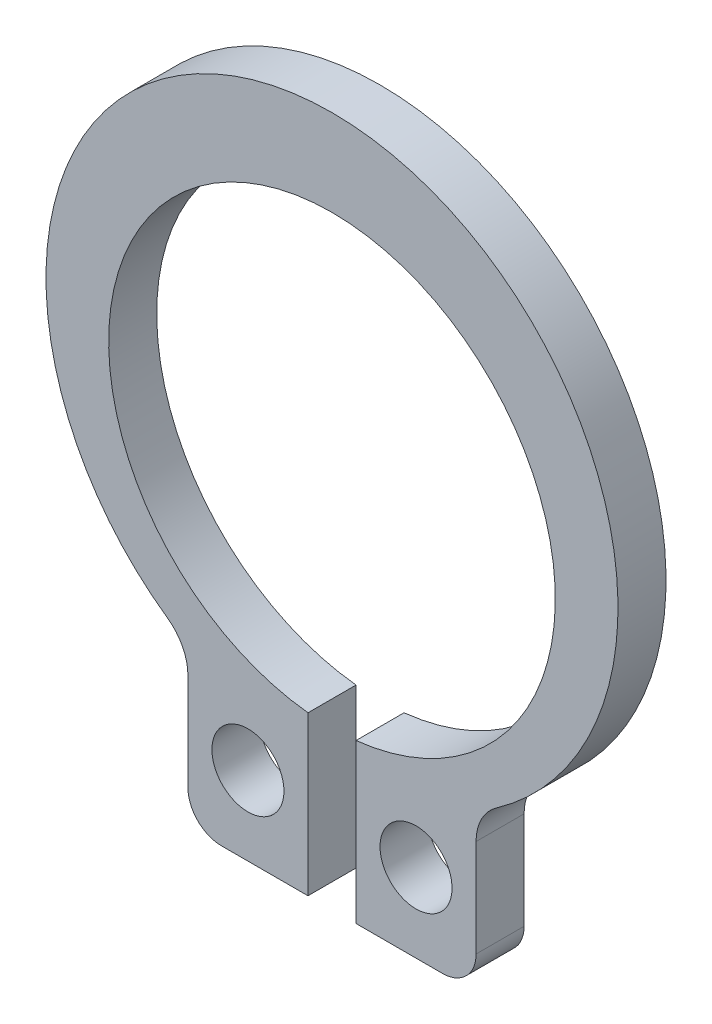
from build123d import *

# Parameters (mm, degrees)
BODYSKE_R      = 0.75
BASEBODY_DEPTH = 1
FILLET1_R      = 1
FILLET2_R      = 0.7


with BuildPart() as part:
    # BodySke → BaseBody (new body)
    with BuildSketch(Plane.XY):
        with BuildLine():
            Line((-0.5, -4.623040125), (-0.5, -7.923040125))
            Line((-0.5, -7.923040125), (-3, -7.923040125))
            Line((-3, -7.923040125), (-3, -4.64912529))
            ThreePointArc((-3, -4.64912529), (0, 6.45), (3, -4.64912529))
            Line((3, -4.64912529), (3, -7.923040125))
            Line((3, -7.923040125), (0.5, -7.923040125))
            Line((0.5, -7.923040125), (0.5, -4.623040125))
            ThreePointArc((0.5, -4.623040125), (0, 4.65), (-0.5, -4.623040125))
        make_face()
        with Locations((-1.75, -6.286082708)):
            Circle(BODYSKE_R, mode=Mode.SUBTRACT)
        with Locations((1.75, -6.286082708)):
            Circle(BODYSKE_R, mode=Mode.SUBTRACT)
    extrude(amount=BASEBODY_DEPTH)

    # Fillet1
    fillet1_edges = [part.edges().sort_by_distance(p)[0] for p in [
        (3, -4.64912529, 0.5),
        (-3, -4.64912529, 0.5),
    ]]
    fillet(fillet1_edges, radius=FILLET1_R)

    # Fillet2
    fillet2_edges = [part.edges().sort_by_distance(p)[0] for p in [
        (3, -7.923040125, 0.5),
        (-3, -7.923040125, 0.5),
    ]]
    fillet(fillet2_edges, radius=FILLET2_R)


solid = part.part
